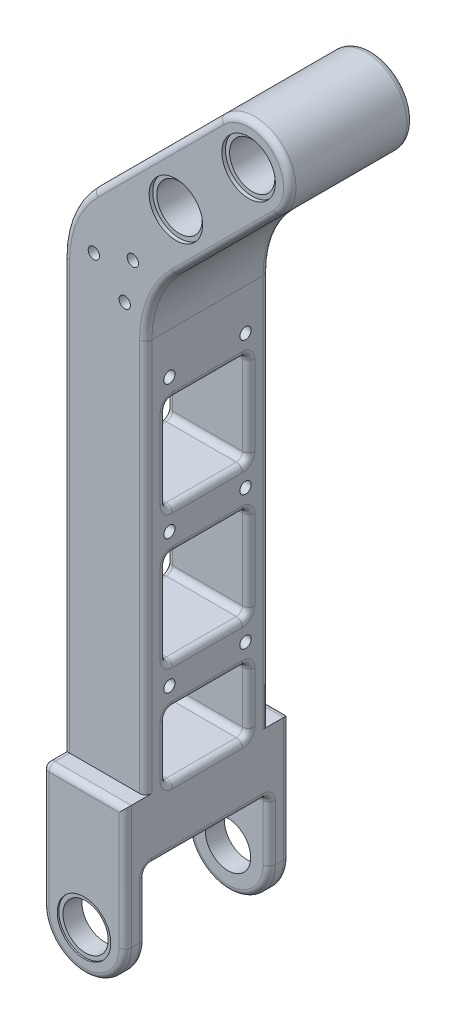
from build123d import *

# Parameters (mm, degrees)
SKETCH_1_R             = 20
SKETCH_1_R_2           = 11
EXTRUDE_1_DEPTH        = 60
EXTRUDE_2_DEPTH        = 30
SKETCH_4_R             = 11
EXTRUDE_3_DEPTH        = 10
SKETCH_8_R             = 11
CUT_EXTRUDE_1_DEPTH    = 100
FILLET_1_R             = 50
FILLET_2_R             = 3
SKETCH_9_R             = 13
CUT_EXTRUDE_2_DEPTH    = 0.75
CUT_EXTRUDE_START      = -0.75
SKETCH_10_R            = 13
CUT_EXTRUDE_3_DEPTH    = 0.75
SKETCH_11_R            = 2.75
CUT_EXTRUDE_4_DEPTH    = 393.300904947
SKETCH_12_W            = 40
SKETCH_12_H            = 45
SKETCH_12_H_2          = 31.005050634
CUT_EXTRUDE_5522_DEPTH = 393.300904947
FILLET_3_R             = 3
SKETCH_13_R            = 13
CUT_EXTRUDE_6_DEPTH    = 1.75
CUT_EXTRUDE_START_2    = -1.75
SKETCH_14_R            = 13
CUT_EXTRUDE_7_DEPTH    = 1.75
SKETCH_15_R            = 2.75
CUT_EXTRUDE_8_DEPTH    = 388.169213652


with BuildPart() as part:
    # 草图1 → 凸台-拉伸1 (new body)
    with BuildSketch(Plane.XY):
        Circle(SKETCH_1_R)
        Circle(SKETCH_1_R_2, mode=Mode.SUBTRACT)
    extrude(amount=EXTRUDE_1_DEPTH)

    # 草图2 → 凸台-拉伸2 (add, symmetric)
    with BuildSketch(Plane.XY.offset(30)):
        with BuildLine():
            Line((-14.142135624, 14.142135624), (-90, -61.715728753))
            Line((-90, -61.715728753), (-90, -320))
            Line((-90, -320), (-50, -320))
            Line((-50, -320), (-50, -78.284271247))
            Line((-50, -78.284271247), (14.142135624, -14.142135624))
            ThreePointArc((14.142135624, -14.142135624), (-14.142135624, -14.142135624), (-14.142135624, 14.142135624))
        make_face()
    extrude(amount=EXTRUDE_2_DEPTH, both=True)

    # 草图4 → 凸台-拉伸3 (add)
    with BuildSketch(Plane.XY.offset(60)):
        with BuildLine():
            Line((-90, -290), (-50, -290))
            Line((-50, -290), (-50, -350))
            ThreePointArc((-50, -350), (-70, -370), (-90, -350))
            Line((-90, -350), (-90, -290))
        make_face()
        with Locations((-70, -350)):
            Circle(SKETCH_4_R, mode=Mode.SUBTRACT)
    extrude_3 = extrude(amount=EXTRUDE_3_DEPTH)

    # 镜向1: 凸台-拉伸3 across plane
    add(extrude_3.mirror(Plane.XY.offset(30)))

    # 草图8 → 切除-拉伸1 (cut)
    with BuildSketch(Plane.XY.offset(60)):
        with Locations((-35.355339059, -35.355339059)):
            Circle(SKETCH_8_R)
    extrude(amount=-CUT_EXTRUDE_1_DEPTH, mode=Mode.SUBTRACT)

    # 圆角1
    fillet_1_edges = [part.edges().sort_by_distance(p)[0] for p in [
        (-90, -61.715728753, 30),
        (-50, -78.284271247, 30),
    ]]
    fillet(fillet_1_edges, radius=FILLET_1_R)

    # 圆角2
    fillet_2_edges = [part.edges().sort_by_distance(p)[0] for p in [
        (-50, -320, 70),
        (-70, -370, 70),
        (-50, -335, 60),
        (-70, -370, 60),
        (-50, -335, 0),
        (-70, -370, 0),
        (-50, -320, -10),
        (-70, -370, -10),
        (-70, -320, 60),
        (-50, -320, 30),
        (-70, -320, 0),
        (-90, -290, 65),
        (-90, -320, 70),
        (-90, -335, 60),
        (-90, -320, 30),
        (-90, -335, 0),
        (-90, -320, -10),
        (-90, -290, -5),
        (-50, -194.497474683, 0),
        (-46.193976626, -79.860777748, 0),
        (-10.606601718, -38.890872965, 0),
        (14.142135624, 14.142135624, 0),
        (-44.748737342, -16.464466094, 0),
        (-86.193976626, -63.292235253, 0),
        (-90, -186.213203436, 0),
        (14.142135624, 14.142135624, 60),
        (-10.606601718, -38.890872965, 60),
        (-46.193976626, -79.860777748, 60),
        (-50, -194.497474683, 60),
        (-90, -186.213203436, 60),
        (-86.193976626, -63.292235253, 60),
        (-44.748737342, -16.464466094, 60),
        (-70, -290, 70),
        (-70, -290, -10),
    ]]
    fillet(fillet_2_edges, radius=FILLET_2_R)

    # 草图9 → 切除-拉伸2 (cut)
    with BuildSketch(Plane.XY.offset(70)):
        with Locations((-70, -350)):
            Circle(SKETCH_9_R)
    extrude(amount=-CUT_EXTRUDE_2_DEPTH, mode=Mode.SUBTRACT)

    # 草图10 → 切除-拉伸3 (cut)
    with BuildSketch(Plane(origin=(0, 0, -10), x_dir=(-1, 0, 0), z_dir=(0, 0, -1)).offset(CUT_EXTRUDE_START)):
        with Locations((70, -350)):
            Circle(SKETCH_10_R)
    extrude(amount=CUT_EXTRUDE_3_DEPTH, mode=Mode.SUBTRACT)

    # 草图11 → 切除-拉伸4 (cut, through all)
    with BuildSketch(Plane.ZY.offset(90)):
        with Locations((48.5, -118.994949366)):
            Circle(SKETCH_11_R)
        with Locations((48.5, -183.994949366)):
            Circle(SKETCH_11_R)
        with Locations((48.5, -248.994949366)):
            Circle(SKETCH_11_R)
        with Locations((11.5, -248.994949366)):
            Circle(SKETCH_11_R)
        with Locations((11.5, -183.994949366)):
            Circle(SKETCH_11_R)
        with Locations((11.5, -118.994949366)):
            Circle(SKETCH_11_R)
    extrude(amount=-CUT_EXTRUDE_4_DEPTH, mode=Mode.SUBTRACT)

    # 草图12 → Cut-Extrude 5522 (cut, through all)
    with BuildSketch(Plane.ZY.offset(90)):
        with Locations((30, -151.494949366)):
            Rectangle(SKETCH_12_W, SKETCH_12_H)
        with Locations((30, -216.494949366)):
            Rectangle(SKETCH_12_W, SKETCH_12_H)
        with Locations((30, -274.497474683)):
            Rectangle(SKETCH_12_W, SKETCH_12_H_2)
    extrude(amount=-CUT_EXTRUDE_5522_DEPTH, mode=Mode.SUBTRACT)

    # 圆角3
    fillet_3_edges = [part.edges().sort_by_distance(p)[0] for p in [
        (-90, -258.994949366, 30),
        (-50, -258.994949366, 30),
        (-50, -290, 30),
        (-90, -290, 30),
        (-50, -238.994949366, 30),
        (-50, -193.994949366, 30),
        (-90, -193.994949366, 30),
        (-90, -238.994949366, 30),
        (-50, -173.994949366, 30),
        (-90, -173.994949366, 30),
        (-50, -128.994949366, 30),
        (-90, -128.994949366, 30),
        (-70, -290, 10),
        (-90, -274.497474683, 10),
        (-70, -258.994949366, 10),
        (-50, -274.497474683, 10),
        (-50, -274.497474683, 50),
        (-70, -258.994949366, 50),
        (-90, -274.497474683, 50),
        (-70, -290, 50),
        (-50, -216.494949366, 50),
        (-70, -193.994949366, 50),
        (-90, -216.494949366, 50),
        (-70, -238.994949366, 50),
        (-70, -238.994949366, 10),
        (-90, -216.494949366, 10),
        (-70, -193.994949366, 10),
        (-50, -216.494949366, 10),
        (-70, -173.994949366, 10),
        (-90, -151.494949366, 10),
        (-70, -128.994949366, 10),
        (-50, -151.494949366, 10),
        (-50, -151.494949366, 50),
        (-70, -128.994949366, 50),
        (-90, -151.494949366, 50),
        (-70, -173.994949366, 50),
    ]]
    fillet(fillet_3_edges, radius=FILLET_3_R)

    # 草图13 → 切除-拉伸6 (cut)
    with BuildSketch(Plane.XY.offset(60)):
        Circle(SKETCH_13_R)
        with Locations((-35.355339059, -35.355339059)):
            Circle(SKETCH_13_R)
    extrude(amount=-CUT_EXTRUDE_6_DEPTH, mode=Mode.SUBTRACT)

    # 草图14 → 切除-拉伸7 (cut)
    with BuildSketch(Plane(origin=(0, 0, 0), x_dir=(-1, 0, 0), z_dir=(0, 0, -1)).offset(CUT_EXTRUDE_START_2)):
        Circle(SKETCH_14_R)
        with Locations((35.355339059, -35.355339059)):
            Circle(SKETCH_14_R)
    extrude(amount=CUT_EXTRUDE_7_DEPTH, mode=Mode.SUBTRACT)

    # 草图15 → 切除-拉伸8 (cut, through all)
    with BuildSketch(Plane(origin=(0, 0, 0), x_dir=(-1, 0, 0), z_dir=(0, 0, -1))):
        with Locations((56.27187054, -67.200533131)):
            Circle(SKETCH_15_R)
        with Locations((75.217187404, -73.609508785)):
            Circle(SKETCH_15_R)
        with Locations((60.194193243, -86.812146645)):
            Circle(SKETCH_15_R)
    extrude(amount=-CUT_EXTRUDE_8_DEPTH, mode=Mode.SUBTRACT)


solid = part.part
